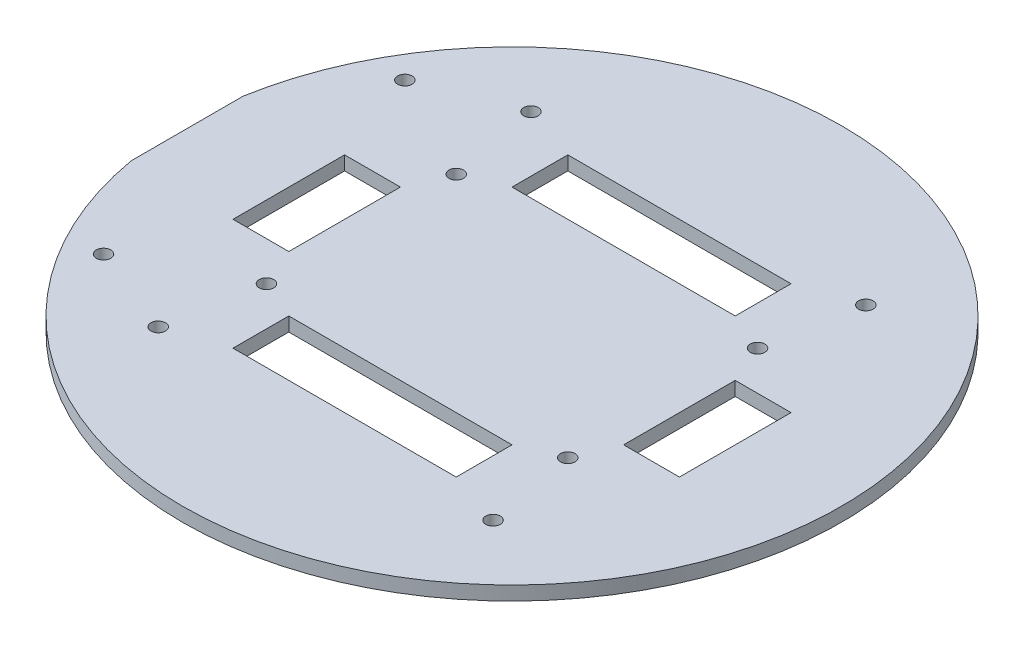
from build123d import *

# Parameters (mm, degrees)
SKETCH1_R           = 1.651
SKETCH1_W           = 50.8
SKETCH1_H           = 12.7
SKETCH1_W_2         = 12.7
SKETCH1_H_2         = 25.4
BOSS_EXTRUDE1_DEPTH = 3.175


with BuildPart() as part:
    # Sketch1 → Boss-Extrude1 (new body)
    with BuildSketch(Plane(origin=(0, 0, 0), x_dir=(1, 0, 0), z_dir=(0, 1, 0))):
        with BuildLine():
            Line((-73.916912814, 12.7), (-73.916912814, -12.7))
            ThreePointArc((-73.916912814, -12.7), (75, 0), (-73.916912814, 12.7))
        make_face()
        with Locations((-34.29, 21.59)):
            Circle(SKETCH1_R, mode=Mode.SUBTRACT)
        with Locations((34.29, 21.59)):
            Circle(SKETCH1_R, mode=Mode.SUBTRACT)
        with Locations((-34.29, -21.59)):
            Circle(SKETCH1_R, mode=Mode.SUBTRACT)
        with Locations((34.29, -21.59)):
            Circle(SKETCH1_R, mode=Mode.SUBTRACT)
        with Locations((38.1, -42.418)):
            Circle(SKETCH1_R, mode=Mode.SUBTRACT)
        with Locations((-38.1, -42.418)):
            Circle(SKETCH1_R, mode=Mode.SUBTRACT)
        with Locations((-58.676912814, -34.29)):
            Circle(SKETCH1_R, mode=Mode.SUBTRACT)
        with Locations((-58.676912814, 34.29)):
            Circle(SKETCH1_R, mode=Mode.SUBTRACT)
        with Locations((-38.1, 42.418)):
            Circle(SKETCH1_R, mode=Mode.SUBTRACT)
        with Locations((38.1, 42.418)):
            Circle(SKETCH1_R, mode=Mode.SUBTRACT)
        with Locations((0, 31.75)):
            Rectangle(SKETCH1_W, SKETCH1_H, mode=Mode.SUBTRACT)
        with Locations((44.45, 0)):
            Rectangle(SKETCH1_W_2, SKETCH1_H_2, mode=Mode.SUBTRACT)
        with Locations((0, -31.75)):
            Rectangle(SKETCH1_W, SKETCH1_H, mode=Mode.SUBTRACT)
        with Locations((-44.45, 0)):
            Rectangle(SKETCH1_W_2, SKETCH1_H_2, mode=Mode.SUBTRACT)
    extrude(amount=BOSS_EXTRUDE1_DEPTH)


solid = part.part
